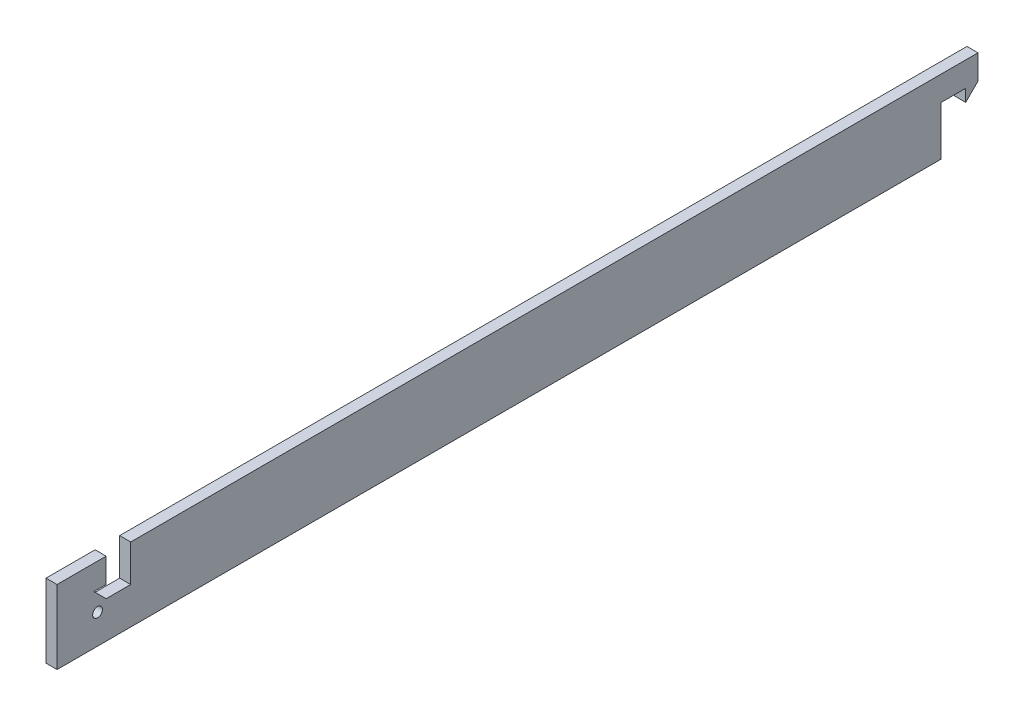
from build123d import *

# Parameters (mm, degrees)
SKETCH1_R           = 2
BOSS_EXTRUDE1_DEPTH = 4.5


with BuildPart() as part:
    # Sketch1 → Boss-Extrude1 (new body)
    with BuildSketch(Plane(origin=(0, 0, 0), x_dir=(0, 0, -1), z_dir=(1, 0, 0))):
        Polygon((-30.84603871, 0), (-40.84603871, 0), (-45.84603871, 5), (-40.84603871, 5), (-40.84603871, 15), (-60.84603871, 15), (-60.84603871, -15), (299.15396129, -15), (299.15396129, 5), (309.15396129, 5), (309.15396129, 0), (314.15396129, 5), (314.15396129, 15), (299.15396129, 15), (-30.84603871, 15), align=None)
        with Locations((-44.34603871, -3)):
            Circle(SKETCH1_R, mode=Mode.SUBTRACT)
    extrude(amount=BOSS_EXTRUDE1_DEPTH)


solid = part.part
